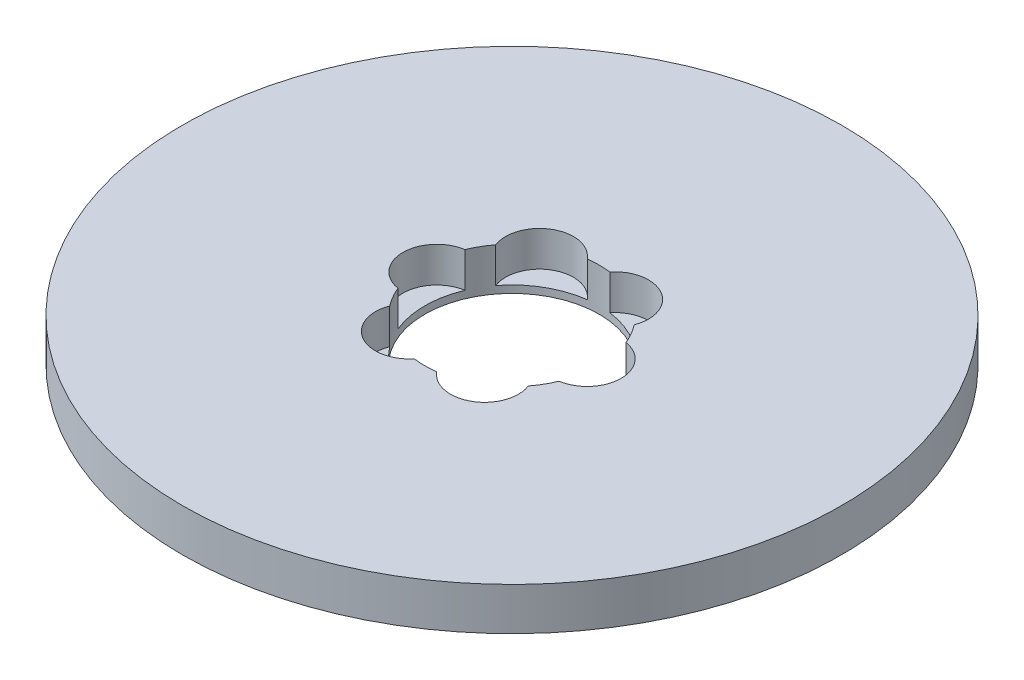
from build123d import *

# Parameters (mm, degrees)
SKETCH1_R           = 85
BOSS_EXTRUDE1_DEPTH = 11
SKETCH2_R           = 22.5
CUT_EXTRUDE1_DEPTH  = 121.710397232
SKETCH3_R           = 8.753565426
CUT_EXTRUDE2_DEPTH  = 9.10522315
CIRPATTERN1_COUNT   = 6


with BuildPart() as part:
    # Sketch1 → Boss-Extrude1 (new body)
    with BuildSketch(Plane(origin=(0, 0, 0), x_dir=(1, 0, 0), z_dir=(0, 1, 0))):
        Circle(SKETCH1_R)
    extrude(amount=BOSS_EXTRUDE1_DEPTH)

    # Sketch2 → Cut-Extrude1 (cut, through all)
    with BuildSketch(Plane(origin=(0, 0, 0), x_dir=(1, 0, 0), z_dir=(0, 1, 0))):
        Circle(SKETCH2_R)
    extrude(amount=CUT_EXTRUDE1_DEPTH, mode=Mode.SUBTRACT)

    # Sketch3 → Cut-Extrude2 (cut)
    with BuildSketch(Plane(origin=(0, 11, 0), x_dir=(1, 0, 0), z_dir=(0, 1, 0))):
        with Locations((-19.386967654, 0)):
            Circle(SKETCH3_R)
    cut_extrude2 = extrude(amount=-CUT_EXTRUDE2_DEPTH, mode=Mode.SUBTRACT)

    # CirPattern1: Cut-Extrude2 ×6 about axis
    cirpattern1_axis = Axis((0, 0, 0), (0, 1, 0))
    for i in range(1, CIRPATTERN1_COUNT):
        add(cut_extrude2.rotate(cirpattern1_axis, i * 360 / CIRPATTERN1_COUNT), mode=Mode.SUBTRACT)


solid = part.part
